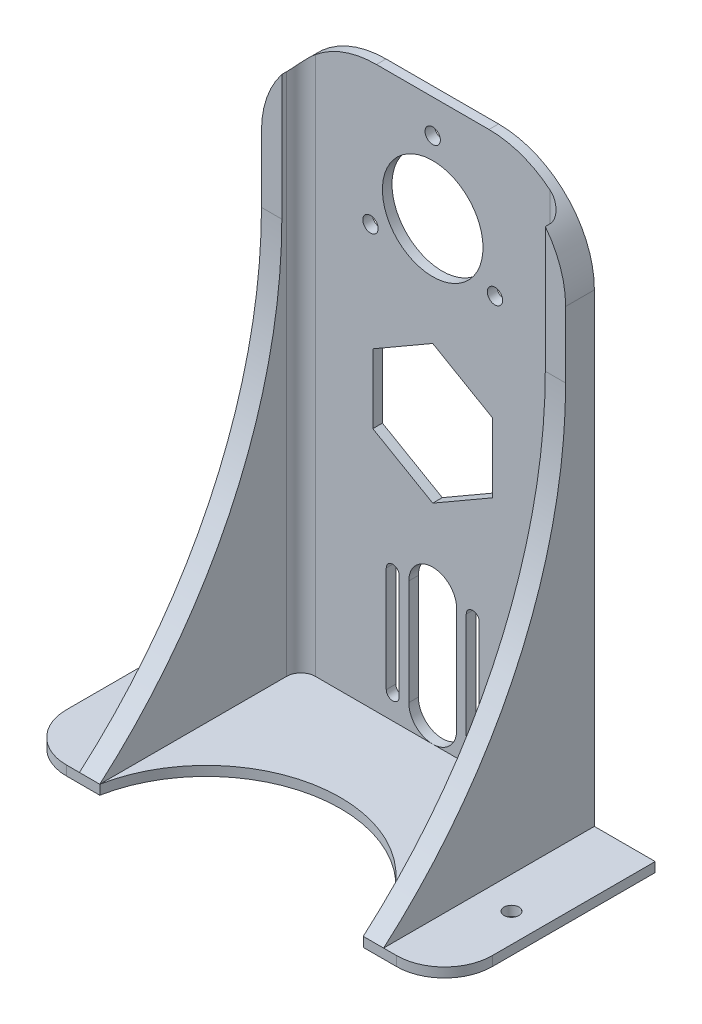
from build123d import *

# Parameters (mm, degrees)
SKETCH1_W           = 88.9
SKETCH1_H           = 90
BASE_DEPTH          = 2
SKETCH2_W           = 63.5
SKETCH2_H           = 6
FACE_PLATE_DEPTH    = 117
SKETCH5_R           = 10.5
SKETCH5_R_2         = 1.6
FACE_HOLES_DEPTH    = 138.261802771
FILLET2_R           = 10
FILLET3_R           = 20
SKETCH23_W          = 55
SKETCH23_H          = 117
CUT_EXTRUDE6_DEPTH  = 4
FILLET4_R           = 110
SKETCH24_W          = 88.9
SKETCH24_H          = 46
CUT_EXTRUDE7_DEPTH  = 3
SKETCH25_R          = 1.55
CUT_EXTRUDE8_DEPTH  = 134.003016883
CUT_EXTRUDE9_DEPTH  = 134.003016883
FILLET5_R           = 3
CUT_EXTRUDE10_DEPTH = 134.793880741


with BuildPart() as part:
    # Sketch1 → Base (new body)
    with BuildSketch(Plane(origin=(0, 0, 0), x_dir=(1, 0, 0), z_dir=(0, 1, 0))):
        Rectangle(SKETCH1_W, SKETCH1_H)
    extrude(amount=BASE_DEPTH)

    # Sketch2 → Face Plate (add)
    with BuildSketch(Plane(origin=(0, 2, 0), x_dir=(1, 0, 0), z_dir=(0, 1, 0))):
        with Locations((0, -4)):
            Rectangle(SKETCH2_W, SKETCH2_H)
    extrude(amount=FACE_PLATE_DEPTH)

    # Sketch5 → Face Holes (cut, through all)
    with BuildSketch(Plane.XY.offset(7)):
        with Locations((0, 97)):
            Circle(SKETCH5_R)
        with Locations((12.990381057, 89.5)):
            Circle(SKETCH5_R_2)
        with Locations((-12.990381057, 89.5)):
            Circle(SKETCH5_R_2)
        with Locations((0, 112)):
            Circle(SKETCH5_R_2)
        with BuildLine():
            Line((-9.7, 7), (-9.7, 29))
            ThreePointArc((-9.7, 29), (-8.35, 30.35), (-7, 29))
            Line((-7, 29), (-7, 7))
            ThreePointArc((-7, 7), (-8.35, 5.65), (-9.7, 7))
        make_face()
        with BuildLine():
            Line((9.7, 29), (9.7, 7))
            ThreePointArc((9.7, 7), (8.35, 5.65), (7, 7))
            Line((7, 7), (7, 29))
            ThreePointArc((7, 29), (8.35, 30.35), (9.7, 29))
        make_face()
        with BuildLine():
            Line((-5, 7), (-5, 29))
            ThreePointArc((-5, 29), (0, 34), (5, 29))
            Line((5, 29), (5, 7))
            ThreePointArc((5, 7), (0, 2), (-5, 7))
        make_face()
    extrude(amount=-FACE_HOLES_DEPTH, mode=Mode.SUBTRACT)

    # Fillet2
    fillet2_edges = [part.edges().sort_by_distance(p)[0] for p in [
        (-44.45, 1, -45),
        (44.45, 1, -45),
        (44.45, 1, 45),
        (-44.45, 1, 45),
    ]]
    fillet(fillet2_edges, radius=FILLET2_R)

    # Fillet3
    fillet3_edges = [part.edges().sort_by_distance(p)[0] for p in [
        (-31.75, 119, 4),
        (31.75, 119, 4),
    ]]
    fillet(fillet3_edges, radius=FILLET3_R)

    # Sketch23 → Cut-Extrude6 (cut)
    with BuildSketch(Plane.XY.offset(7)):
        with Locations((0, 60.5)):
            Rectangle(SKETCH23_W, SKETCH23_H)
    extrude(amount=-CUT_EXTRUDE6_DEPTH, mode=Mode.SUBTRACT)

    # Fillet4
    # the kernel refuses this fillet: 110 mm, written as the material it adds along each edge
    with BuildSketch(Plane(origin=(-180.406228863, 2, 7), x_dir=(0, 0, 1), z_dir=(1, 0, 0))) as fillet4_piece_1_section:
        with BuildLine():
            CenterArc((110, -83.162491545), FILLET4_R, 130.885192893, 49.114807107)
            Line((0, -83.162491545), (0, 0))
            Line((0, 0), (38, 0))
        make_face()
    fillet4_piece_1 = extrude(amount=420.062457726, mode=Mode.PRIVATE)
    fillet4_piece_1 = split(fillet4_piece_1, bisect_by=Plane(origin=(-31.75, 51.263709825, 12.122352248), z_dir=(1, 0, 0)), keep=Keep.TOP, mode=Mode.PRIVATE)
    fillet4_piece_1 = split(fillet4_piece_1, bisect_by=Plane(origin=(-27.5, 51.263709825, 12.122352248), z_dir=(-1, 0, 0)), keep=Keep.TOP, mode=Mode.PRIVATE)
    add(fillet4_piece_1)
    with BuildSketch(Plane(origin=(27.5, 2, 7), x_dir=(0, 0, 1), z_dir=(1, 0, 0)), Plane(origin=(-31.75, 2, 7), x_dir=(0, 0, 1), z_dir=(1, 0, 0))) as fillet4_piece_2:
        with BuildLine():
            CenterArc((110, -83.162491545), FILLET4_R, 130.885192893, 49.114807107)
            Line((0, -83.162491545), (0, 0))
            Line((0, 0), (38, 0))
        make_face()
    extrude(amount=4.25)
    with BuildSketch(Plane(origin=(-239.656228863, 2, 7), x_dir=(0, 0, 1), z_dir=(1, 0, 0))) as fillet4_piece_3_section:
        with BuildLine():
            CenterArc((110, -83.162491545), FILLET4_R, 130.885192893, 49.114807107)
            Line((0, -83.162491545), (0, 0))
            Line((0, 0), (38, 0))
        make_face()
    fillet4_piece_3 = extrude(amount=420.062457726, mode=Mode.PRIVATE)
    fillet4_piece_3 = split(fillet4_piece_3, bisect_by=Plane(origin=(31.75, 51.263709825, 12.122352248), z_dir=(-1, 0, 0)), keep=Keep.TOP, mode=Mode.PRIVATE)
    fillet4_piece_3 = split(fillet4_piece_3, bisect_by=Plane(origin=(27.5, 51.263709825, 12.122352248), z_dir=(1, 0, 0)), keep=Keep.TOP, mode=Mode.PRIVATE)
    add(fillet4_piece_3)

    # Sketch24 → Cut-Extrude7 (cut)
    with BuildSketch(Plane(origin=(0, 2, 0), x_dir=(1, 0, 0), z_dir=(0, 1, 0))):
        with Locations((0, 22)):
            Rectangle(SKETCH24_W, SKETCH24_H)
    extrude(amount=-CUT_EXTRUDE7_DEPTH, mode=Mode.SUBTRACT)

    # Sketch25 → Cut-Extrude8 (cut, through all)
    with BuildSketch(Plane(origin=(0, 2, 0), x_dir=(1, 0, 0), z_dir=(0, 1, 0))):
        with Locations(Location((38.45, -25, 0), (0, 0, 270))):
            Circle(SKETCH25_R)
        with Locations(Location((-38.45, -25, 0), (0, 0, 270))):
            Circle(SKETCH25_R)
    extrude(amount=-CUT_EXTRUDE8_DEPTH, mode=Mode.SUBTRACT)

    # Sketch26 → Cut-Extrude9 (cut, through all)
    with BuildSketch(Plane(origin=(0, 2, 0), x_dir=(1, 0, 0), z_dir=(0, 1, 0))):
        with BuildLine():
            Line((-27.5, -45), (27.5, -45))
            ThreePointArc((27.5, -45), (0, -22.267826876), (-27.5, -45))
        make_face()
    extrude(amount=-CUT_EXTRUDE9_DEPTH, mode=Mode.SUBTRACT)

    # Fillet5
    fillet5_edges = [part.edges().sort_by_distance(p)[0] for p in [
        (27.5, 56.663146518, 3),
        (-27.5, 56.663146518, 3),
    ]]
    fillet(fillet5_edges, radius=FILLET5_R)

    # Sketch27 → Cut-Extrude10 (cut, through all)
    with BuildSketch(Plane.XY.offset(3)):
        Polygon((0, 45.56624327), (12.5, 52.783121635), (12.5, 67.216878365), (0, 74.43375673), (-12.5, 67.216878365), (-12.5, 52.783121635), align=None)
    extrude(amount=-CUT_EXTRUDE10_DEPTH, mode=Mode.SUBTRACT)


solid = part.part
